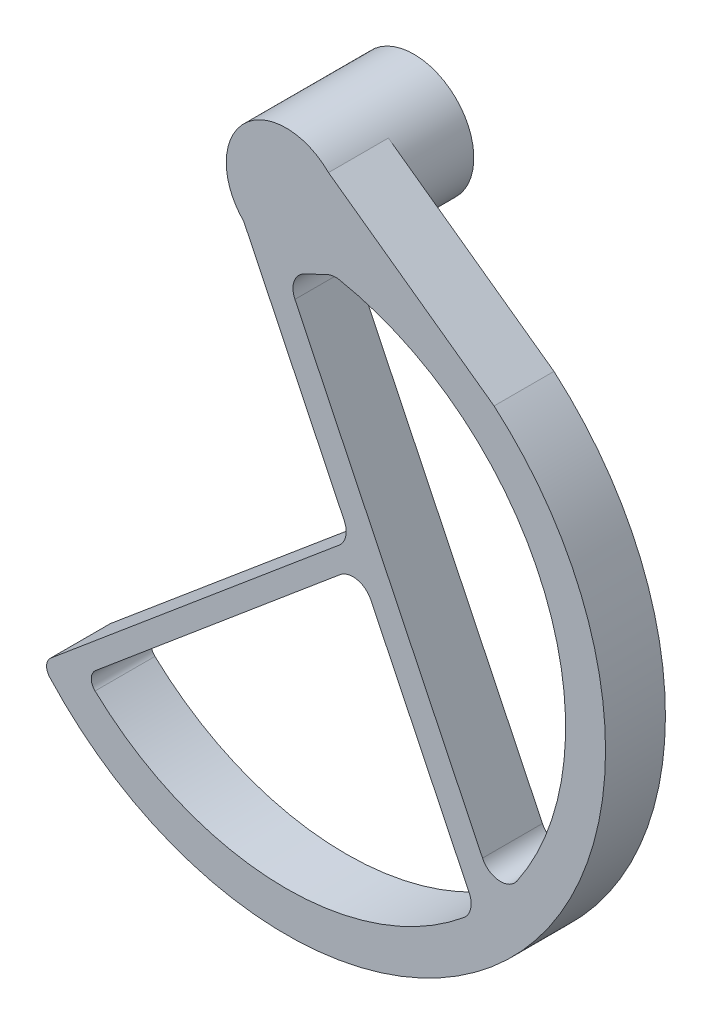
from build123d import *

# Parameters (mm, degrees)
EXTRUDE_1_DEPTH     = 15
CUT_EXTRUDE_START   = -15
CUT_EXTRUDE_1_DEPTH = 15
EXTRUDE_START       = 17
SKETCH_11_R         = 15
EXTRUDE_3_DEPTH     = 17
SKETCH_12_R         = 10.1
CUT_EXTRUDE_5_DEPTH = 2


with BuildPart() as part:
    # ｽｹｯﾁ4 → ﾎﾞｽ - 押し出し1 (new body)
    with BuildSketch(Plane.XY):
        with BuildLine():
            Line((13.244185189, -68.886809092), (-53.623111018, -124.995132678))
            Line((-53.623111018, -124.995132678), (-58.940636287, -129.45706617))
            ThreePointArc((-58.940636287, -129.45706617), (-60.005384698, -131.552012131), (-59.233530865, -133.771635843))
            ThreePointArc((-59.233530865, -133.771635843), (-58.595754044, -134.465930709), (-57.949839695, -135.15266158))
            ThreePointArc((-57.949839695, -135.15266158), (58.01545948, -135.083631519), (52.076178918, -19.270504783))
            Line((52.076178918, -19.270504783), (10.606601718, 10.606601718))
            ThreePointArc((10.606601718, 10.606601718), (-10.606601718, 10.606601718), (-10.606601718, -10.606601718))
            Line((-10.606601718, -10.606601718), (14.536280154, -62.889638219))
            ThreePointArc((14.536280154, -62.889638219), (14.918089499, -66.109676181), (13.244185189, -68.886809092))
        make_face()
        with BuildLine():
            ThreePointArc((13.511229465, -75.151532228), (17.77869109, -74.092739753), (21.232400696, -76.813798404))
            Line((21.232400696, -76.813798404), (45.844843506, -127.993820346))
            ThreePointArc((45.844843506, -127.993820346), (46.221944165, -131.235480845), (44.518718993, -134.019289696))
            ThreePointArc((44.518718993, -134.019289696), (-2.231208213, -149.964431749), (-47.870174388, -131.072951785))
            ThreePointArc((-47.870174388, -131.072951785), (-48.817477846, -128.802229421), (-47.747678417, -126.586582094))
            Line((-47.747678417, -126.586582094), (13.511229465, -75.151532228))
        make_face(mode=Mode.SUBTRACT)
    extrude(amount=EXTRUDE_1_DEPTH)

    # ｽｹｯﾁ6 → ｶｯﾄ - 押し出し1 (cut)
    with BuildSketch(Plane.XY.offset(15).offset(CUT_EXTRUDE_START)):
        with BuildLine():
            Line((49.189589797, -118.797265215), (2.201751786, -21.089020696))
            ThreePointArc((2.201751786, -21.089020696), (1.989274209, -17.268089629), (4.540836142, -14.416039025))
            Line((4.540836142, -14.416039025), (6.483415605, -13.48185369))
            Line((6.483415605, -13.48185369), (10.219658847, -11.685096486))
            ThreePointArc((10.219658847, -11.685096486), (11.747077013, -11.232198087), (13.339423466, -11.282754846))
            ThreePointArc((13.339423466, -11.282754846), (64.738421392, -53.37413296), (57.826055334, -119.448033215))
            ThreePointArc((57.826055334, -119.448033215), (53.319931874, -121.616182211), (49.189589797, -118.797265215))
        make_face()
    extrude(amount=CUT_EXTRUDE_1_DEPTH, mode=Mode.SUBTRACT)

    # ｽｹｯﾁ11 → ﾎﾞｽ - 押し出し3 (add)
    with BuildSketch(Plane(origin=(0, 0, 0), x_dir=(-1, 0, 0), z_dir=(0, 0, -1)).offset(EXTRUDE_START)):
        Circle(SKETCH_11_R)
    extrude(amount=-EXTRUDE_3_DEPTH)

    # ｽｹｯﾁ12 → ｶｯﾄ - 押し出し5 (cut)
    with BuildSketch(Plane(origin=(0, 0, -17), x_dir=(-1, 0, 0), z_dir=(0, 0, -1))):
        Circle(SKETCH_12_R)
    extrude(amount=-CUT_EXTRUDE_5_DEPTH, mode=Mode.SUBTRACT)


solid = part.part
